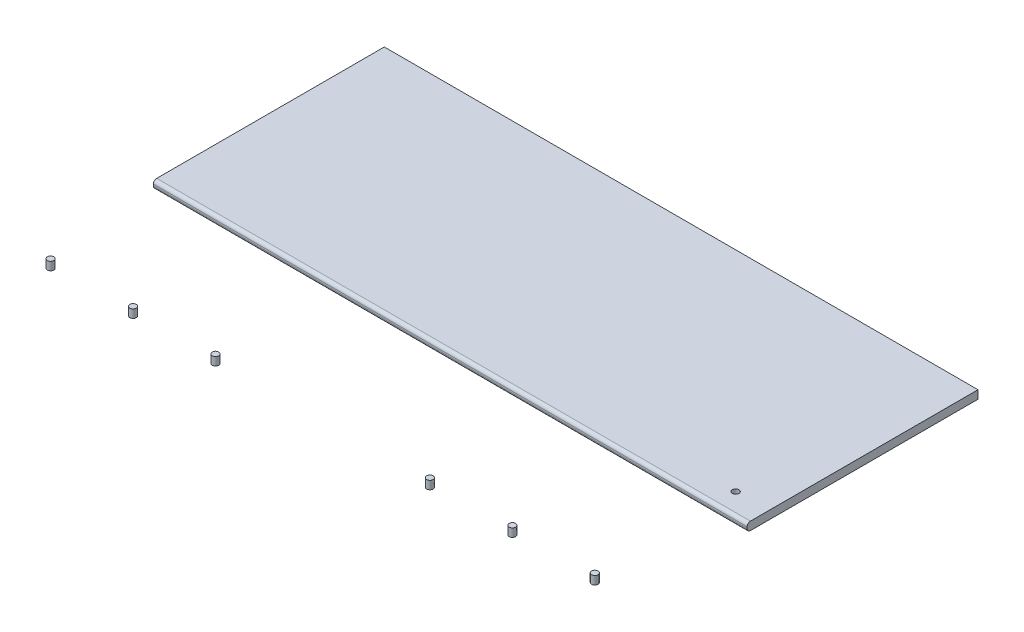
from build123d import *

# Parameters (mm, degrees)
SKETCH1_R             = 2.5019
BOSS_EXTRUDE1_DEPTH   = 6.35
BOSS_EXTRUDE1_2_DEPTH = 6.35
BOSS_EXTRUDE1_3_DEPTH = 6.35
BOSS_EXTRUDE1_4_DEPTH = 6.35
BOSS_EXTRUDE1_5_DEPTH = 6.35
BOSS_EXTRUDE1_6_DEPTH = 6.35
SKETCH1_W             = 457.2
SKETCH1_H             = 177.8
BOSS_EXTRUDE1_7_DEPTH = 6.35
FILLET1_R             = 2.54
SKETCH4_R             = 2.54
CUT_EXTRUDE3_DEPTH    = 294.077932832


with BuildPart() as part:
    # Sketch1 → Boss-Extrude1 (new body)
    with BuildSketch(Plane(origin=(0, 0, 0), x_dir=(1, 0, 0), z_dir=(0, 1, 0))):
        with Locations((203.2, -180.791286488)):
            Circle(SKETCH1_R)
    extrude(amount=BOSS_EXTRUDE1_DEPTH)


with BuildPart() as body_2:
    # Sketch1 → Boss-Extrude1 2 (new body)
    with BuildSketch(Plane(origin=(0, 0, 0), x_dir=(1, 0, 0), z_dir=(0, 1, 0))):
        with Locations((139.7, -180.791286488)):
            Circle(SKETCH1_R)
    extrude(amount=BOSS_EXTRUDE1_2_DEPTH)


with BuildPart() as body_3:
    # Sketch1 → Boss-Extrude1 3 (new body)
    with BuildSketch(Plane(origin=(0, 0, 0), x_dir=(1, 0, 0), z_dir=(0, 1, 0))):
        with Locations((76.2, -180.791286488)):
            Circle(SKETCH1_R)
    extrude(amount=BOSS_EXTRUDE1_3_DEPTH)


with BuildPart() as body_4:
    # Sketch1 → Boss-Extrude1 4 (new body)
    with BuildSketch(Plane(origin=(0, 0, 0), x_dir=(1, 0, 0), z_dir=(0, 1, 0))):
        with Locations((-88.9, -180.791286488)):
            Circle(SKETCH1_R)
    extrude(amount=BOSS_EXTRUDE1_4_DEPTH)


with BuildPart() as body_5:
    # Sketch1 → Boss-Extrude1 5 (new body)
    with BuildSketch(Plane(origin=(0, 0, 0), x_dir=(1, 0, 0), z_dir=(0, 1, 0))):
        with Locations((-152.4, -180.791286488)):
            Circle(SKETCH1_R)
    extrude(amount=BOSS_EXTRUDE1_5_DEPTH)


with BuildPart() as body_6:
    # Sketch1 → Boss-Extrude1 6 (new body)
    with BuildSketch(Plane(origin=(0, 0, 0), x_dir=(1, 0, 0), z_dir=(0, 1, 0))):
        with Locations((-215.9, -180.791286488)):
            Circle(SKETCH1_R)
    extrude(amount=BOSS_EXTRUDE1_6_DEPTH)


with BuildPart() as body_7:
    # Sketch1 → Boss-Extrude1 7 (new body)
    with BuildSketch(Plane(origin=(0, 0, 0), x_dir=(1, 0, 0), z_dir=(0, 1, 0))):
        Rectangle(SKETCH1_W, SKETCH1_H)
    extrude(amount=BOSS_EXTRUDE1_7_DEPTH)

    # Fillet1
    fillet1_edges = [body_7.edges().sort_by_distance(p)[0] for p in [
        (0, 0, 88.9),
        (0, 6.35, 88.9),
    ]]
    fillet(fillet1_edges, radius=FILLET1_R)

    # Sketch4 → Cut-Extrude3 (cut, through all)
    with BuildSketch(Plane.XZ):
        with Locations((203.2, 72.3392)):
            Circle(SKETCH4_R)
    extrude(amount=-CUT_EXTRUDE3_DEPTH, mode=Mode.SUBTRACT)


solid = Compound([part.part, body_2.part, body_3.part, body_4.part, body_5.part, body_6.part, body_7.part])
